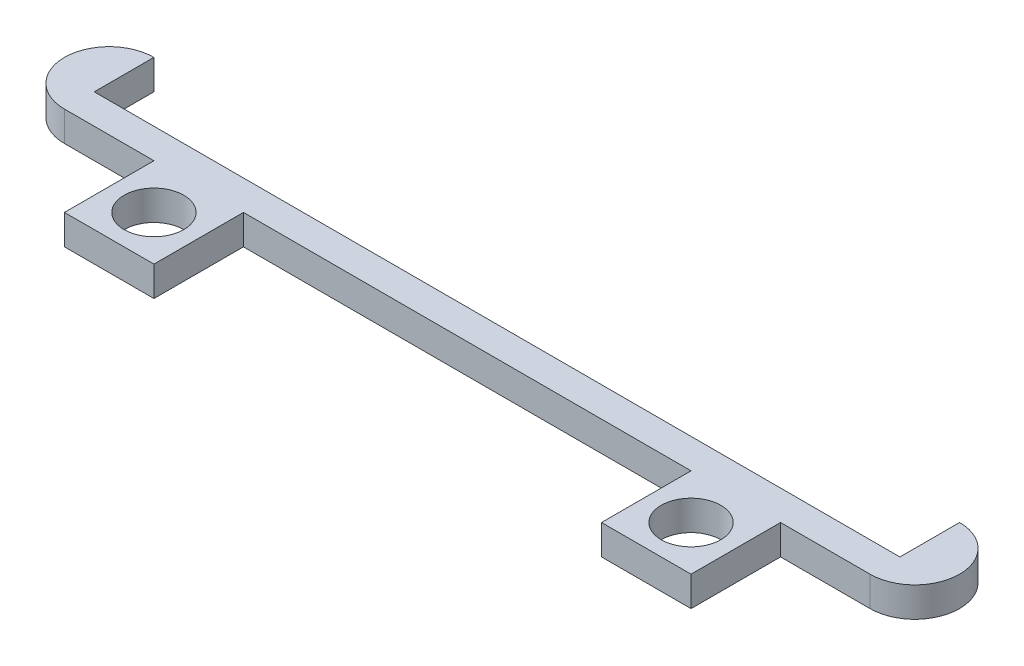
from build123d import *

# Parameters (mm, degrees)
SKETCH2_R           = 5
BOSS_EXTRUDE1_DEPTH = 5
SKETCH2_4_W         = 135
SKETCH2_4_H         = 10
CUT_EXTRUDE2_DEPTH  = 79.461774132


with BuildPart() as part:
    # Sketch2 → Boss-Extrude1 (new body)
    with BuildSketch(Plane(origin=(0, 0, 0), x_dir=(1, 0, 0), z_dir=(0, 1, 0))):
        with BuildLine():
            Line((52.5, -7.5), (67.5, -7.5))
            ThreePointArc((67.5, -7.5), (75, 0), (67.5, 7.5))
            Line((67.5, 7.5), (-67.5, 7.5))
            ThreePointArc((-67.5, 7.5), (-75, 0), (-67.5, -7.5))
            Line((-67.5, -7.5), (-52.5, -7.5))
            Line((-52.5, -7.5), (-52.5, -22.5))
            Line((-52.5, -22.5), (-37.5, -22.5))
            Line((-37.5, -22.5), (-37.5, -7.5))
            Line((-37.5, -7.5), (37.5, -7.5))
            Line((37.5, -7.5), (37.5, -22.5))
            Line((37.5, -22.5), (52.5, -22.5))
            Line((52.5, -22.5), (52.5, -7.5))
        make_face()
        with Locations((45, -15)):
            Circle(SKETCH2_R, mode=Mode.SUBTRACT)
        with Locations((-45, -15)):
            Circle(SKETCH2_R, mode=Mode.SUBTRACT)
    extrude(amount=BOSS_EXTRUDE1_DEPTH)

    # Sketch2<4> → Cut-Extrude2 (cut, through all)
    with BuildSketch(Plane(origin=(0, 0, 0), x_dir=(1, 0, 0), z_dir=(0, 1, 0))):
        with Locations((0, 2.5)):
            Rectangle(SKETCH2_4_W, SKETCH2_4_H)
    extrude(amount=CUT_EXTRUDE2_DEPTH, mode=Mode.SUBTRACT)


solid = part.part
